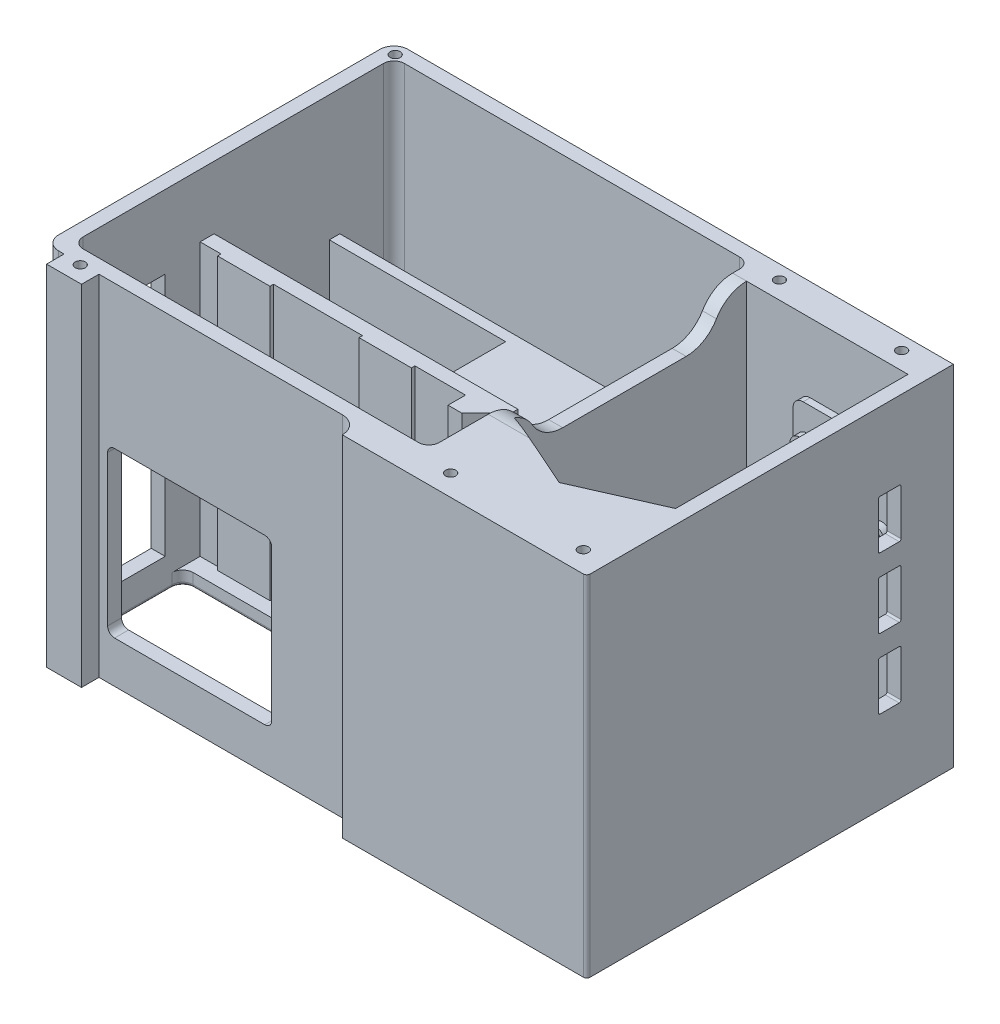
from build123d import *

# Parameters (mm, degrees)
EXTRUDE_1_DEPTH           = 100
SHELL_START               = -46
SHELL_1_OUTLINE_W         = 102
SHELL_1_OUTLINE_H         = 96
SHELL_1_DEPTH             = 92
CUT_EXTRUDE_1_REACH       = 126.599
CUT_EXTRUDE_2_DEPTH       = 2
CUT_EXTRUDE_3_REACH       = 126.599
FILLET_1_R                = 3
SKETCH_6_W                = 102
SKETCH_6_H                = 4
EXTRUDE_2_DEPTH           = 78
SKETCH_7_W                = 15
SKETCH_7_H                = 1
EXTRUDE_3_DEPTH           = 78
SKETCH_9_W                = 15
SKETCH_9_H                = 1
EXTRUDE_4_DEPTH           = 78
EXTRUDE_5_DEPTH           = 78
CUT_EXTRUDE_4_REACH       = 128.906
SKETCH_13_W               = 15
SKETCH_13_H               = 20
SKETCH_15_W               = 103.117220955
SKETCH_15_H               = 3
EXTRUDE_7_DEPTH           = 60
SKETCH_16_W               = 2
SKETCH_16_H               = 33
EXTRUDE_8_DEPTH           = 60
SKETCH_17_W               = 50.5
SKETCH_17_H               = 17.1
EXTRUDE_9_DEPTH           = 60
CUT_EXTRUDE_5_REACH       = 153.74
CUT_EXTRUDE_6_REACH       = 158.844
SKETCH_19_W               = 22
SKETCH_19_H               = 70
SKETCH_20_W               = 6.214315857
SKETCH_20_H               = 1.6
SKETCH_20_W_2             = 4.175230567
EXTRUDE_10_DEPTH          = 78
EXTRUDE_11_DEPTH          = 60
FILLET_2_R                = 3
FILLET_3_R                = 3
EXTRUDE_12_DEPTH          = 100
SKETCH_23_W               = 70
SKETCH_23_H               = 5
SKETCH_23_W_2             = 10
EXTRUDE_13_DEPTH          = 100
FILLET_5_R                = 1
FILLET_6_R                = 1
FILLET_7_R                = 1
SKETCH_24_W               = 46.214975384
SKETCH_24_H               = 92
CUT_EXTRUDE_7_DEPTH       = 96
SKETCH_25_W               = 46.214975384
SKETCH_25_H               = 5
EXTRUDE_14_DEPTH          = 96
CUT_EXTRUDE_8_DEPTH       = 38
CUT_EXTRUDE_8_DEPTH_BACK  = 19
CUT_EXTRUDE_9_DEPTH       = 50
CUT_EXTRUDE_9_DEPTH_BACK  = 29
EXTRUDE_15_DEPTH          = 2
SKETCH_31_R               = 2.8
SKETCH_31_R_2             = 1.7
SKETCH_31_R_3             = 2.9
EXTRUDE_16_DEPTH          = 2
FILLET_8_R                = 1
FILLET_9_R                = 5
EXTRUDE_START             = -30
EXTRUDE_17_DEPTH          = 30
CUT_EXTRUDE_11_DEPTH      = 65
EXTRUDE_18_DEPTH          = 96
HOLE_WIZARD_M3_5_1_D      = 2.9
HOLE_WIZARD_M3_5_1_DEPTH  = 9.128752102
HOLE_WIZARD_M3_5_1_TIP    = 0.871247898
SKETCH_39_W               = 50
SKETCH_39_H               = 10
CUT_EXTRUDE_12_DEPTH      = 23
FILLET_10_R               = 10
FILLET_11_R               = 10
CUT_EXTRUDE_13_DEPTH      = 15
EXTRUDE_START_2           = -15
EXTRUDE_19_DEPTH          = 15
CUT_EXTRUDE_15_DEPTH      = 26
CUT_EXTRUDE_15_DEPTH_BACK = 87
SKETCH_43_R               = 4.75
CUT_EXTRUDE_16_DEPTH      = 10


# Read off the part's stored shape, not the designer's step: 抽壳1
# Some blends are built 0.0001 mm under size
with BuildPart() as part:
    # 草图2 → 凸台-拉伸1 (new body)
    with BuildSketch(Plane(origin=(0, 0, 0), x_dir=(1, 0, 0), z_dir=(0, 1, 0))):
        with BuildLine():
            Line((-51, 50), (51, 50))
            ThreePointArc((51, 50), (53.828427125, 48.828427125), (55, 46))
            Line((55, 46), (55, -46))
            ThreePointArc((55, -46), (53.828427125, -48.828427125), (51, -50))
            Line((51, -50), (-51, -50))
            ThreePointArc((-51, -50), (-53.828427125, -48.828427125), (-55, -46))
            Line((-55, -46), (-55, 46))
            ThreePointArc((-55, 46), (-53.828427125, 48.828427125), (-51, 50))
        make_face()
    extrude(amount=EXTRUDE_1_DEPTH)

    # 抽壳1 outline → 抽壳1 (cut)
    with BuildSketch(Plane.XY.offset(SHELL_START)):
        with Locations((0, 52)):
            Rectangle(SHELL_1_OUTLINE_W, SHELL_1_OUTLINE_H)
    extrude(amount=SHELL_1_DEPTH, mode=Mode.SUBTRACT)

    # 草图3 → 切除-拉伸1 (cut, up to next)
    with BuildSketch(Plane.XZ, mode=Mode.PRIVATE) as cut_extrude_1_sk1:
        with BuildLine():
            Line((-48, 40), (11, 40))
            ThreePointArc((11, 40), (13.121320344, 39.121320344), (14, 37))
            Line((14, 37), (14, 17.5))
            ThreePointArc((14, 17.5), (13.121320344, 15.378679656), (11, 14.5))
            Line((11, 14.5), (-48, 14.5))
            ThreePointArc((-48, 14.5), (-50.121320344, 15.378679656), (-51, 17.5))
            Line((-51, 17.5), (-51, 37))
            ThreePointArc((-51, 37), (-50.121320344, 39.121320344), (-48, 40))
        make_face()
    cut_extrude_1_tool1 = extrude(cut_extrude_1_sk1.sketch, amount=-CUT_EXTRUDE_1_REACH, mode=Mode.PRIVATE) & part.part
    add(cut_extrude_1_tool1.solids().sort_by_distance((-18.5, 0, 27.25))[0], mode=Mode.SUBTRACT)

    # 草图4 → 切除-拉伸2 (cut)
    with BuildSketch(Plane.XZ):
        with BuildLine():
            Line((11, 40), (46, 40))
            ThreePointArc((46, 40), (48.121320344, 39.121320344), (49, 37))
            Line((49, 37), (49, 17.5))
            ThreePointArc((49, 17.5), (48.121320344, 15.378679656), (46, 14.5))
            Line((46, 14.5), (11, 14.5))
            ThreePointArc((11, 14.5), (13.121320344, 15.378679656), (14, 17.5))
            Line((14, 17.5), (14, 37))
            ThreePointArc((14, 37), (13.121320344, 39.121320344), (11, 40))
        make_face()
    extrude(amount=-CUT_EXTRUDE_2_DEPTH, mode=Mode.SUBTRACT)

    # 草图5 → 切除-拉伸3 (cut, up to next)
    with BuildSketch(Plane.XZ, mode=Mode.PRIVATE) as cut_extrude_3_sk1:
        with BuildLine():
            Line((3.5, -13), (48, -13))
            ThreePointArc((48, -13), (49.414213562, -13.585786438), (50, -15))
            Line((50, -15), (50, -24.5))
            ThreePointArc((50, -24.5), (49.414213562, -25.914213562), (48, -26.5))
            Line((48, -26.5), (3.5, -26.5))
            ThreePointArc((3.5, -26.5), (2.085786438, -25.914213562), (1.5, -24.5))
            Line((1.5, -24.5), (1.5, -15))
            ThreePointArc((1.5, -15), (2.085786438, -13.585786438), (3.5, -13))
        make_face()
    cut_extrude_3_tool1 = extrude(cut_extrude_3_sk1.sketch, amount=-CUT_EXTRUDE_3_REACH, mode=Mode.PRIVATE) & part.part
    # 草图5 → 切除-拉伸3 (cut, up to next)
    with BuildSketch(Plane.XZ, mode=Mode.PRIVATE) as cut_extrude_3_sk2:
        with BuildLine():
            Line((-48, -13), (-3.5, -13))
            ThreePointArc((-3.5, -13), (-2.085786438, -13.585786438), (-1.5, -15))
            Line((-1.5, -15), (-1.5, -24.5))
            ThreePointArc((-1.5, -24.5), (-2.085786438, -25.914213562), (-3.5, -26.5))
            Line((-3.5, -26.5), (-48, -26.5))
            ThreePointArc((-48, -26.5), (-49.414213562, -25.914213562), (-50, -24.5))
            Line((-50, -24.5), (-50, -15))
            ThreePointArc((-50, -15), (-49.414213562, -13.585786438), (-48, -13))
        make_face()
    cut_extrude_3_tool2 = extrude(cut_extrude_3_sk2.sketch, amount=-CUT_EXTRUDE_3_REACH, mode=Mode.PRIVATE) & part.part
    # 草图5 → 切除-拉伸3 (cut, up to next)
    with BuildSketch(Plane.XZ, mode=Mode.PRIVATE) as cut_extrude_3_sk3:
        with BuildLine():
            Line((-48, -31.5), (-3.5, -31.5))
            ThreePointArc((-3.5, -31.5), (-2.085786438, -32.085786438), (-1.5, -33.5))
            Line((-1.5, -33.5), (-1.5, -43))
            ThreePointArc((-1.5, -43), (-2.085786438, -44.414213562), (-3.5, -45))
            Line((-3.5, -45), (-48, -45))
            ThreePointArc((-48, -45), (-49.414213562, -44.414213562), (-50, -43))
            Line((-50, -43), (-50, -33.5))
            ThreePointArc((-50, -33.5), (-49.414213562, -32.085786438), (-48, -31.5))
        make_face()
    cut_extrude_3_tool3 = extrude(cut_extrude_3_sk3.sketch, amount=-CUT_EXTRUDE_3_REACH, mode=Mode.PRIVATE) & part.part
    # 草图5 → 切除-拉伸3 (cut, up to next)
    with BuildSketch(Plane.XZ, mode=Mode.PRIVATE) as cut_extrude_3_sk4:
        with BuildLine():
            Line((3.5, -31.5), (48, -31.5))
            ThreePointArc((48, -31.5), (49.414213562, -32.085786438), (50, -33.5))
            Line((50, -33.5), (50, -43))
            ThreePointArc((50, -43), (49.414213562, -44.414213562), (48, -45))
            Line((48, -45), (3.5, -45))
            ThreePointArc((3.5, -45), (2.085786438, -44.414213562), (1.5, -43))
            Line((1.5, -43), (1.5, -33.5))
            ThreePointArc((1.5, -33.5), (2.085786438, -32.085786438), (3.5, -31.5))
        make_face()
    cut_extrude_3_tool4 = extrude(cut_extrude_3_sk4.sketch, amount=-CUT_EXTRUDE_3_REACH, mode=Mode.PRIVATE) & part.part
    add(cut_extrude_3_tool1.solids().sort_by_distance((25.75, 0, -19.75))[0], mode=Mode.SUBTRACT)
    add(cut_extrude_3_tool2.solids().sort_by_distance((-25.75, 0, -19.75))[0], mode=Mode.SUBTRACT)
    add(cut_extrude_3_tool3.solids().sort_by_distance((-25.75, 0, -38.25))[0], mode=Mode.SUBTRACT)
    add(cut_extrude_3_tool4.solids().sort_by_distance((25.75, 0, -38.25))[0], mode=Mode.SUBTRACT)

    # 圆角1
    fillet_1_edges = [part.edges().sort_by_distance(p)[0] for p in [
        (51, 52, -46),
        (-51, 52, -46),
        (-51, 52, 46),
        (51, 52, 46),
    ]]
    fillet(fillet_1_edges, radius=FILLET_1_R)

    # 草图6 → 凸台-拉伸2 (add)
    with BuildSketch(Plane(origin=(0, 4, 0), x_dir=(1, 0, 0), z_dir=(0, 1, 0))):
        with Locations((0, -7.5)):
            Rectangle(SKETCH_6_W, SKETCH_6_H)
    extrude(amount=EXTRUDE_2_DEPTH)

    # 草图7 → 凸台-拉伸3 (add)
    with BuildSketch(Plane(origin=(0, 4, 0), x_dir=(1, 0, 0), z_dir=(0, 1, 0))):
        with Locations((-37.5, -10)):
            Rectangle(SKETCH_7_W, SKETCH_7_H)
    extrude(amount=EXTRUDE_3_DEPTH)

    # 草图9 → 凸台-拉伸4 (add)
    with BuildSketch(Plane(origin=(0, 4, 0), x_dir=(1, 0, 0), z_dir=(0, 1, 0))):
        with Locations((3, -10)):
            Rectangle(SKETCH_9_W, SKETCH_9_H)
    extrude(amount=EXTRUDE_4_DEPTH)

    # 草图10 → 凸台-拉伸5 (add)
    with BuildSketch(Plane(origin=(0, 4, 0), x_dir=(1, 0, 0), z_dir=(0, 1, 0))):
        Polygon((29, -9.5), (25, -9.5), (25, -14.5), (29, -14.5), (34, -9.5), align=None)
    extrude(amount=EXTRUDE_5_DEPTH)

    # 草图13 → 切除-拉伸4 (cut, up to next)
    with BuildSketch(Plane(origin=(0, 0, 5.5), x_dir=(-1, 0, 0), z_dir=(0, 0, -1)), mode=Mode.PRIVATE) as cut_extrude_4_sk1:
        with Locations((-43.5, 72)):
            Rectangle(SKETCH_13_W, SKETCH_13_H)
    cut_extrude_4_tool1 = extrude(cut_extrude_4_sk1.sketch, amount=-CUT_EXTRUDE_4_REACH, mode=Mode.PRIVATE) & part.part
    add(cut_extrude_4_tool1.solids().sort_by_distance((43.5, 72, 5.5))[0], mode=Mode.SUBTRACT)

    # 草图15 → 凸台-拉伸7 (add)
    with BuildSketch(Plane(origin=(0, 4, 0), x_dir=(1, 0, 0), z_dir=(0, 1, 0))):
        with Locations((0.558610478, 29)):
            Rectangle(SKETCH_15_W, SKETCH_15_H)
    extrude(amount=EXTRUDE_7_DEPTH)

    # 草图16 → 凸台-拉伸8 (add)
    with BuildSketch(Plane(origin=(0, 4, 0), x_dir=(1, 0, 0), z_dir=(0, 1, 0))):
        with Locations((0.5, 11)):
            Rectangle(SKETCH_16_W, SKETCH_16_H)
    extrude(amount=EXTRUDE_8_DEPTH)

    # 草图17 → 凸台-拉伸9 (add)
    with BuildSketch(Plane(origin=(0, 4, 0), x_dir=(1, 0, 0), z_dir=(0, 1, 0))):
        with Locations((-25.75, 3.05)):
            Rectangle(SKETCH_17_W, SKETCH_17_H)
    extrude(amount=EXTRUDE_9_DEPTH)

    # 草图18 → 切除-拉伸5 (cut, up to next)
    with BuildSketch(Plane.XY.offset(50), mode=Mode.PRIVATE) as cut_extrude_5_sk1:
        with BuildLine():
            Line((-35, 59), (8, 59))
            ThreePointArc((8, 59), (9.414213562, 58.414213562), (10, 57))
            Line((10, 57), (10, 14))
            ThreePointArc((10, 14), (9.414213562, 12.585786438), (8, 12))
            Line((8, 12), (-35, 12))
            ThreePointArc((-35, 12), (-36.414213562, 12.585786438), (-37, 14))
            Line((-37, 14), (-37, 57))
            ThreePointArc((-37, 57), (-36.414213562, 58.414213562), (-35, 59))
        make_face()
    cut_extrude_5_tool1 = extrude(cut_extrude_5_sk1.sketch, amount=-CUT_EXTRUDE_5_REACH, mode=Mode.PRIVATE) & part.part
    add(cut_extrude_5_tool1.solids().sort_by_distance((-13.5, 35.5, 50))[0], mode=Mode.SUBTRACT)

    # 草图19 → 切除-拉伸6 (cut, up to next)
    with BuildSketch(Plane.ZY.offset(55), mode=Mode.PRIVATE) as cut_extrude_6_sk1:
        with Locations((30.5, 44)):
            Rectangle(SKETCH_19_W, SKETCH_19_H)
    cut_extrude_6_tool1 = extrude(cut_extrude_6_sk1.sketch, amount=-CUT_EXTRUDE_6_REACH, mode=Mode.PRIVATE) & part.part
    add(cut_extrude_6_tool1.solids().sort_by_distance((-55, 44, 30.5))[0], mode=Mode.SUBTRACT)

    # 草图20 → 凸台-拉伸10 (add)
    with BuildSketch(Plane(origin=(0, 4, 0), x_dir=(1, 0, 0), z_dir=(0, 1, 0))):
        with Locations((15.22548023, -45.2)):
            Rectangle(SKETCH_20_W, SKETCH_20_H)
        with Locations((-45.912384717, -45.2)):
            Rectangle(SKETCH_20_W_2, SKETCH_20_H)
    extrude(amount=EXTRUDE_10_DEPTH)

    # 草图21 → 凸台-拉伸11 (add)
    with BuildSketch(Plane(origin=(0, 4, 0), x_dir=(1, 0, 0), z_dir=(0, 1, 0))):
        Polygon((51, 11.6), (1.5, 11.6), (1.5, -5.5), (36, -5.5), (51, -5.5), align=None)
        with BuildLine():
            Line((1.5, 15), (1.5, 11.6))
            Line((1.5, 11.6), (51, 11.6))
            Line((51, 11.6), (51, 27.5))
            Line((51, 27.5), (1.5, 27.5))
            Line((1.5, 27.5), (1.5, 24.5))
            ThreePointArc((1.5, 24.5), (2.085786438, 25.914213562), (3.5, 26.5))
            Line((3.5, 26.5), (48, 26.5))
            ThreePointArc((48, 26.5), (49.414213562, 25.914213562), (50, 24.5))
            Line((50, 24.5), (50, 15))
            ThreePointArc((50, 15), (49.414213562, 13.585786438), (48, 13))
            Line((48, 13), (3.5, 13))
            ThreePointArc((3.5, 13), (2.085786438, 13.585786438), (1.5, 15))
        make_face()
    extrude(amount=EXTRUDE_11_DEPTH)

    # 圆角2
    # the kernel refuses this fillet: 3 mm, written as the material it adds along each edge
    with BuildSketch(Plane(origin=(28.928932188, 62, 5.5), x_dir=(0, 0, 1), z_dir=(1, 0, 0))) as fillet_2_piece_1:
        with BuildLine():
            CenterArc((2.828427125, -3), FILLET_2_R, 90, 70.528779366)
            Line((0, -2), (0, 0))
            Line((0, 0), (2.828427125, 0))
        make_face()
    extrude(amount=22.071067812)

    # 圆角3
    fillet_3_edges = [part.edges().sort_by_distance(p)[0] for p in [
        (43.5, 64, 5.5),
    ]]
    fillet(fillet_3_edges, radius=FILLET_3_R)

    # 草图22 → 凸台-拉伸12 (add)
    with BuildSketch(Plane.XZ):
        with BuildLine():
            Line((51, 50), (105.214975384, 50))
            Line((105.214975384, 50), (105.214975384, -50))
            Line((105.214975384, -50), (51, -50))
            ThreePointArc((51, -50), (53.828427125, -48.828427125), (55, -46))
            Line((55, -46), (55, 46))
            ThreePointArc((55, 46), (53.828427125, 48.828427125), (51, 50))
        make_face()
    extrude(amount=-EXTRUDE_12_DEPTH)

    # 草图23 → 凸台-拉伸13 (add)
    with BuildSketch(Plane.XZ):
        with Locations((70.214975384, 52.5)):
            Rectangle(SKETCH_23_W, SKETCH_23_H)
        with Locations((-44.468062182, 52.5)):
            Rectangle(SKETCH_23_W_2, SKETCH_23_H)
    extrude(amount=-EXTRUDE_13_DEPTH)

    # 圆角5
    fillet_5_edges = [part.edges().sort_by_distance(p)[0] for p in [
        (28.5, 2, 40),
        (48.121320344, 2, 39.121320344),
        (49, 2, 27.25),
        (48.121320344, 2, 15.378679656),
        (28.5, 2, 14.5),
    ]]
    fillet(fillet_5_edges, radius=FILLET_5_R)

    # 圆角6
    fillet_6_edges = [part.edges().sort_by_distance(p)[0] for p in [
        (-1, 0, 14.5),
        (-50.121320344, 0, 15.378679656),
        (-51, 0, 27.25),
        (-50.121320344, 0, 39.121320344),
        (-1, 0, 40),
        (48.121320344, 0, 39.121320344),
        (49, 0, 27.25),
        (48.121320344, 0, 15.378679656),
    ]]
    fillet(fillet_6_edges, radius=FILLET_6_R - 0.0001)  # a hair under: the kernel refuses the full size

    # 圆角7
    fillet_7_edges = [part.edges().sort_by_distance(p)[0] for p in [
        (-2.085786438, 0, -32.085786438),
        (-25.75, 0, -31.5),
        (-49.414213562, 0, -32.085786438),
        (-50, 0, -38.25),
        (-49.414213562, 0, -44.414213562),
        (-25.75, 0, -45),
        (-2.085786438, 0, -44.414213562),
        (-1.5, 0, -38.25),
        (-2.085786438, 0, -13.585786438),
        (-25.75, 0, -13),
        (-49.414213562, 0, -13.585786438),
        (-50, 0, -19.75),
        (-49.414213562, 0, -25.914213562),
        (-25.75, 0, -26.5),
        (-2.085786438, 0, -25.914213562),
        (-1.5, 0, -19.75),
        (49.414213562, 0, -32.085786438),
        (25.75, 0, -31.5),
        (2.085786438, 0, -32.085786438),
        (1.5, 0, -38.25),
        (2.085786438, 0, -44.414213562),
        (25.75, 0, -45),
        (49.414213562, 0, -44.414213562),
        (50, 0, -38.25),
    ]]
    fillet(fillet_7_edges, radius=FILLET_7_R)

    # 草图24 → 切除-拉伸7 (cut)
    with BuildSketch(Plane(origin=(0, 100, 0), x_dir=(1, 0, 0), z_dir=(0, 1, 0))):
        with Locations((78.107487692, 0)):
            Rectangle(SKETCH_24_W, SKETCH_24_H)
    extrude(amount=-CUT_EXTRUDE_7_DEPTH, mode=Mode.SUBTRACT)

    # 草图25 → 凸台-拉伸14 (add)
    with BuildSketch(Plane(origin=(0, 4, 0), x_dir=(1, 0, 0), z_dir=(0, 1, 0))):
        with Locations((78.107487692, 43.5)):
            Rectangle(SKETCH_25_W, SKETCH_25_H)
    extrude(amount=EXTRUDE_14_DEPTH)

    # 草图27 → 切除-拉伸8 (cut, two sides: drawn at the far end of the back side and taken through both)
    with BuildSketch(Plane.XZ.offset(-CUT_EXTRUDE_8_DEPTH_BACK)):
        with BuildLine():
            Line((76.295366545, -28.5), (89.295417345, -28.5))
            ThreePointArc((89.295417345, -28.5), (89.648970736, -28.646446609), (89.795417345, -29))
            Line((89.795417345, -29), (89.795417345, -34.5))
            ThreePointArc((89.795417345, -34.5), (89.648970736, -34.853553391), (89.295417345, -35))
            Line((89.295417345, -35), (76.295366545, -35))
            ThreePointArc((76.295366545, -35), (75.941813154, -34.853553391), (75.795366545, -34.5))
            Line((75.795366545, -34.5), (75.795366545, -29))
            ThreePointArc((75.795366545, -29), (75.941813154, -28.646446609), (76.295366545, -28.5))
        make_face()
    extrude(amount=CUT_EXTRUDE_8_DEPTH + CUT_EXTRUDE_8_DEPTH_BACK, mode=Mode.SUBTRACT)

    # 草图28 → 切除-拉伸9 (cut, two sides: drawn at the far end of the back side and taken through both)
    with BuildSketch(Plane(origin=(105.214975384, 0, 0), x_dir=(0, 0, -1), z_dir=(1, 0, 0)).offset(-CUT_EXTRUDE_9_DEPTH_BACK)):
        with BuildLine():
            Line((35, 64.251663703), (35, 77.251714503))
            ThreePointArc((35, 77.251714503), (34.853553391, 77.605267894), (34.5, 77.751714503))
            Line((34.5, 77.751714503), (29, 77.751714503))
            ThreePointArc((29, 77.751714503), (28.646446609, 77.605267894), (28.5, 77.251714503))
            Line((28.5, 77.251714503), (28.5, 64.251663703))
            ThreePointArc((28.5, 64.251663703), (28.646446609, 63.898110313), (29, 63.751663703))
            Line((29, 63.751663703), (34.5, 63.751663703))
            ThreePointArc((34.5, 63.751663703), (34.853553391, 63.898110313), (35, 64.251663703))
        make_face()
        with BuildLine():
            Line((35, 44.251612903), (35, 57.251663703))
            ThreePointArc((35, 57.251663703), (34.853553391, 57.605217094), (34.5, 57.751663703))
            Line((34.5, 57.751663703), (29, 57.751663703))
            ThreePointArc((29, 57.751663703), (28.646446609, 57.605217094), (28.5, 57.251663703))
            Line((28.5, 57.251663703), (28.5, 44.251612903))
            ThreePointArc((28.5, 44.251612903), (28.646446609, 43.898059513), (29, 43.751612903))
            Line((29, 43.751612903), (34.5, 43.751612903))
            ThreePointArc((34.5, 43.751612903), (34.853553391, 43.898059513), (35, 44.251612903))
        make_face()
        with BuildLine():
            Line((35, 24.251587503), (35, 37.251638303))
            ThreePointArc((35, 37.251638303), (34.853553391, 37.605191694), (34.5, 37.751638303))
            Line((34.5, 37.751638303), (29, 37.751638303))
            ThreePointArc((29, 37.751638303), (28.646446609, 37.605191694), (28.5, 37.251638303))
            Line((28.5, 37.251638303), (28.5, 24.251587503))
            ThreePointArc((28.5, 24.251587503), (28.646446609, 23.898034113), (29, 23.751587503))
            Line((29, 23.751587503), (34.5, 23.751587503))
            ThreePointArc((34.5, 23.751587503), (34.853553391, 23.898034113), (35, 24.251587503))
        make_face()
    extrude(amount=CUT_EXTRUDE_9_DEPTH + CUT_EXTRUDE_9_DEPTH_BACK, mode=Mode.SUBTRACT)

    # 草图30 → 凸台-拉伸15 (add)
    with BuildSketch(Plane.XY.offset(-41)):
        with BuildLine():
            Line((101.223078473, 77.285699771), (101.223078473, 4.00813353))
            Line((101.223078473, 4.00813353), (70.283756707, 4.00813353))
            Line((70.283756707, 4.00813353), (70.283756707, 77.285699771))
            ThreePointArc((70.283756707, 77.285699771), (71.133147042, 79.336309437), (73.183756707, 80.185699771))
            Line((73.183756707, 80.185699771), (98.323078473, 80.185699771))
            ThreePointArc((98.323078473, 80.185699771), (100.373688138, 79.336309437), (101.223078473, 77.285699771))
        make_face()
    extrude(amount=EXTRUDE_15_DEPTH)

    # 草图31 → 凸台-拉伸16 (add)
    # profile 1 of 4: a face of its own
    with BuildSketch(Plane.XY.offset(-39)):
        with Locations(Location((74.195366545, 70.117762103, 0), (0, 0, 90))):
            Circle(SKETCH_31_R)
        with Locations(Location((74.195366545, 70.117762103, 0), (0, 0, 90))):
            Circle(SKETCH_31_R_2, mode=Mode.SUBTRACT)
    # profile 2 of 4: a face of its own
    with BuildSketch(Plane.XY.offset(-39)):
        with Locations(Location((95.714366545, 58.810562103, 0), (0, 0, 180))):
            Circle(SKETCH_31_R_3)
        with Locations(Location((95.714366545, 58.810562103, 0), (0, 0, 90))):
            Circle(SKETCH_31_R_2, mode=Mode.SUBTRACT)
    # profile 3 of 4: a face of its own
    with BuildSketch(Plane.XY.offset(-39)):
        with Locations(Location((95.195417345, 9.351562103, 0), (0, 0, 90))):
            Circle(SKETCH_31_R)
        with Locations(Location((95.195417345, 9.351562103, 0), (0, 0, 90))):
            Circle(SKETCH_31_R_2, mode=Mode.SUBTRACT)
    # profile 4 of 4: a face of its own
    with BuildSketch(Plane.XY.offset(-39)):
        with Locations(Location((74.195366545, 9.351562103, 0), (0, 0, 90))):
            Circle(SKETCH_31_R)
        with Locations(Location((74.195366545, 9.351562103, 0), (0, 0, 90))):
            Circle(SKETCH_31_R_2, mode=Mode.SUBTRACT)
    extrude(amount=EXTRUDE_16_DEPTH)

    # 圆角8
    fillet_8_edges = [part.edges().sort_by_distance(p)[0] for p in [
        (105.214975384, 50, 55),
    ]]
    fillet(fillet_8_edges, radius=FILLET_8_R)

    # 圆角9
    fillet_9_edges = [part.edges().sort_by_distance(p)[0] for p in [
        (35.214975384, 50, 50),
    ]]
    fillet(fillet_9_edges, radius=FILLET_9_R - 0.0001)  # a hair under: the kernel refuses the full size

    # 草图32 → 凸台-拉伸17 (add)
    with BuildSketch(Plane(origin=(0, 64, 0), x_dir=(1, 0, 0), z_dir=(0, 1, 0)).offset(EXTRUDE_START)):
        with BuildLine():
            Line((1.5, 15), (1.5, 24.5))
            ThreePointArc((1.5, 24.5), (2.085786438, 25.914213562), (3.5, 26.5))
            Line((3.5, 26.5), (48, 26.5))
            ThreePointArc((48, 26.5), (49.414213562, 25.914213562), (50, 24.5))
            Line((50, 24.5), (50, 15))
            ThreePointArc((50, 15), (49.414213562, 13.585786438), (48, 13))
            Line((48, 13), (3.5, 13))
            ThreePointArc((3.5, 13), (2.085786438, 13.585786438), (1.5, 15))
        make_face()
    extrude(amount=EXTRUDE_17_DEPTH)

    # 草图34 → 切除-拉伸11 (cut)
    with BuildSketch(Plane.XZ.offset(-34)):
        with BuildLine():
            Line((48, -13), (44, -13))
            Line((44, -13), (44, -26.5))
            Line((44, -26.5), (48, -26.5))
            ThreePointArc((48, -26.5), (49.414213562, -25.914213562), (50, -24.5))
            Line((50, -24.5), (50, -15))
            ThreePointArc((50, -15), (49.414213562, -13.585786438), (48, -13))
        make_face()
    extrude(amount=-CUT_EXTRUDE_11_DEPTH, mode=Mode.SUBTRACT)

    # 草图36 → 凸台-拉伸18 (add)
    with BuildSketch(Plane(origin=(0, 4, 0), x_dir=(1, 0, 0), z_dir=(0, 1, 0))):
        Polygon((78.107487692, -35.775621369), (101.214975384, -46), (101.214975384, -25.551242737), align=None)
        Polygon((55, -46), (101.214975384, -46), (78.107487692, -35.775621369), align=None)
        Polygon((55, -46), (78.107487692, -35.775621369), (55, -25.551242737), align=None)
    extrude(amount=EXTRUDE_18_DEPTH)

    # M3.5 螺纹孔1
    with Locations(Plane(origin=(0, 100, 0), x_dir=(1, 0, 0), z_dir=(0, 1, 0))):
        with Locations((98.214975384, -48.977955399), (60.214975384, -48.977955399), (94.391625653, 46), (59.391625653, 46), (-44.468062182, -50.360148647), (-51.519821375, 46.879485601)):
            Hole(HOLE_WIZARD_M3_5_1_D / 2, depth=HOLE_WIZARD_M3_5_1_DEPTH)
            with Locations((0, 0, -(HOLE_WIZARD_M3_5_1_DEPTH + HOLE_WIZARD_M3_5_1_TIP / 2))):  # 118° drill point
                Cone(0, HOLE_WIZARD_M3_5_1_D / 2, HOLE_WIZARD_M3_5_1_TIP, mode=Mode.SUBTRACT)

    # 草图39 → 切除-拉伸12 (cut)
    with BuildSketch(Plane.ZY.offset(-51)):
        with Locations((-6, 95)):
            Rectangle(SKETCH_39_W, SKETCH_39_H)
    extrude(amount=-CUT_EXTRUDE_12_DEPTH, mode=Mode.SUBTRACT)

    # 圆角10
    fillet_10_edges = [part.edges().sort_by_distance(p)[0] for p in [
        (53, 100, 19),
        (53, 100, -31),
    ]]
    fillet(fillet_10_edges, radius=FILLET_10_R - 0.0001)  # a hair under: the kernel refuses the full size

    # 圆角11
    fillet_11_edges = [part.edges().sort_by_distance(p)[0] for p in [
        (53, 90, 19),
        (53, 90, -31),
    ]]
    fillet(fillet_11_edges, radius=FILLET_11_R)

    # 草图40 → 切除-拉伸13 (cut)
    with BuildSketch(Plane.XZ.offset(-34)):
        with BuildLine():
            Line((44, -26.5), (44, -13))
            Line((44, -13), (3.5, -13))
            ThreePointArc((3.5, -13), (2.085786438, -13.585786438), (1.5, -15))
            Line((1.5, -15), (1.5, -24.5))
            ThreePointArc((1.5, -24.5), (2.085786438, -25.914213562), (3.5, -26.5))
            Line((3.5, -26.5), (44, -26.5))
        make_face()
    extrude(amount=-CUT_EXTRUDE_13_DEPTH, mode=Mode.SUBTRACT)

    # 草图41 → 凸台-拉伸19 (add)
    with BuildSketch(Plane(origin=(0, 64, 0), x_dir=(1, 0, 0), z_dir=(0, 1, 0)).offset(EXTRUDE_START_2)):
        with BuildLine():
            Line((48, 26.5), (44, 26.5))
            Line((44, 26.5), (44, 13))
            Line((44, 13), (48, 13))
            ThreePointArc((48, 13), (49.414213562, 13.585786438), (50, 15))
            Line((50, 15), (50, 24.5))
            ThreePointArc((50, 24.5), (49.414213562, 25.914213562), (48, 26.5))
        make_face()
    extrude(amount=EXTRUDE_19_DEPTH)

    # 草图42 → 切除-拉伸15 (cut, two sides: drawn at the far end of the back side and taken through both)
    with BuildSketch(Plane.XZ.offset(-49).offset(-CUT_EXTRUDE_15_DEPTH_BACK)):
        Polygon((36.946625706, -23), (36.946625706, -13), (44.946625706, -13), (44.946625706, -23), (44.946625706, -26.5), (36.946625706, -26.5), align=None)
    extrude(amount=CUT_EXTRUDE_15_DEPTH + CUT_EXTRUDE_15_DEPTH_BACK, mode=Mode.SUBTRACT)

    # 草图43 → 切除-拉伸16 (cut)
    with BuildSketch(Plane.XZ.offset(-49)):
        with Locations(Location((25.970908587, -20.571944643, 0), (0, 0, 270))):
            Circle(SKETCH_43_R)
    extrude(amount=-CUT_EXTRUDE_16_DEPTH, mode=Mode.SUBTRACT)


solid = part.part
